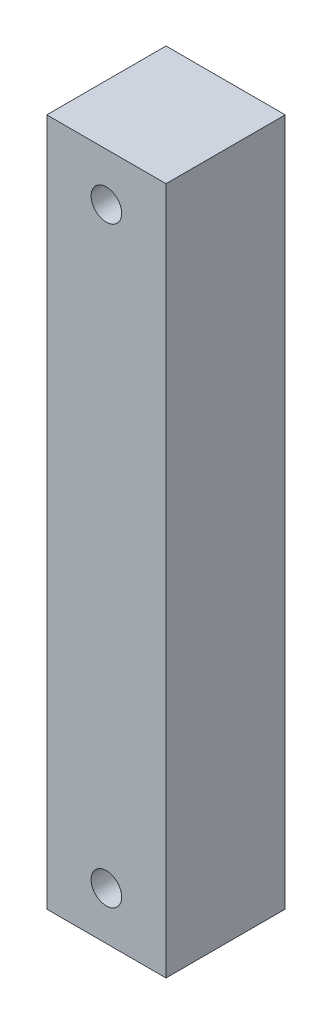
from build123d import *

# Parameters (mm, degrees)
SKETCH1_W           = 11.7
SKETCH1_H           = 11.7
BOSS_EXTRUDE1_DEPTH = 67.5
SKETCH2_R           = 1.5
CUT_EXTRUDE1_DEPTH  = 69.755817936
SKETCH3_R           = 1.5
CUT_EXTRUDE2_DEPTH  = 69.755817936


with BuildPart() as part:
    # Sketch1 → Boss-Extrude1 (new body)
    with BuildSketch(Plane(origin=(0, 0, 0), x_dir=(1, 0, 0), z_dir=(0, 1, 0))):
        Rectangle(SKETCH1_W, SKETCH1_H)
    extrude(amount=BOSS_EXTRUDE1_DEPTH)

    # Sketch2 → Cut-Extrude1 (cut, through all)
    with BuildSketch(Plane.XY.offset(5.85)):
        with Locations((0, 62.8)):
            Circle(SKETCH2_R)
    extrude(amount=-CUT_EXTRUDE1_DEPTH, mode=Mode.SUBTRACT)

    # Sketch3 → Cut-Extrude2 (cut, through all)
    with BuildSketch(Plane.XY.offset(5.85)):
        with Locations((0, 4.7)):
            Circle(SKETCH3_R)
    extrude(amount=-CUT_EXTRUDE2_DEPTH, mode=Mode.SUBTRACT)


solid = part.part
